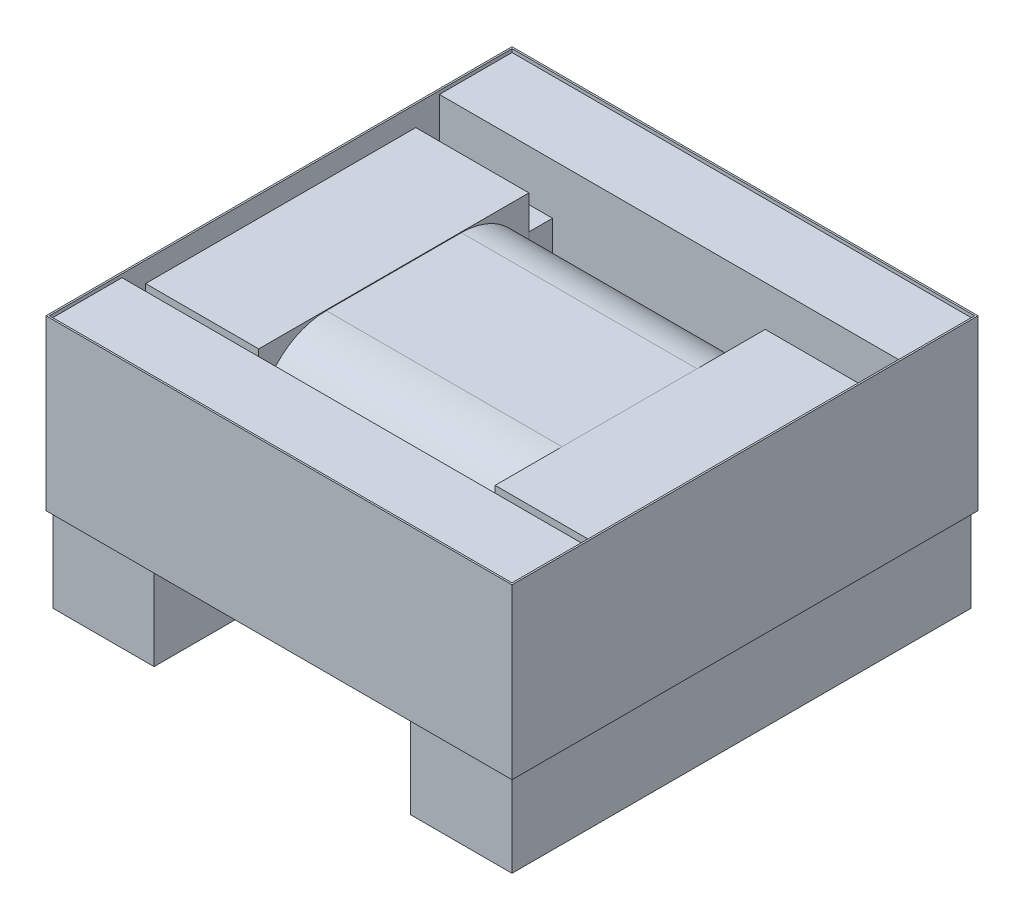
from build123d import *

# Parameters (mm, degrees)
ESBO_O1_W                = 13.8
ESBO_O1_H                = 13.8
RESSALTO_EXTRUS_O1_DEPTH = 5
ESBO_O3_W                = 3
ESBO_O3_H                = 13.6
RESSALTO_EXTRUS_O3_DEPTH = 2.5
ESBO_O4_W                = 13.7
ESBO_O4_H                = 13.7
CORTE_EXTRUS_O1_DEPTH    = 0.1
ESBO_O5_W                = 13.7
ESBO_O5_H                = 9.4
CORTE_EXTRUS_O2_DEPTH    = 0.5
ESBO_O6_W                = 13.7
ESBO_O6_H                = 0.7
CORTE_EXTRUS_O3_DEPTH    = 1
ESBO_O7_W                = 7
ESBO_O7_H                = 0.7
CORTE_EXTRUS_O4_DEPTH    = 10
ESBO_O8_W                = 7
ESBO_O8_H                = 8
CORTE_EXTRUS_O5_DEPTH    = 0.02
FILETE1_R                = 2


with BuildPart() as part:
    # Esboço1 → Ressalto-extrusão1 (new body)
    with BuildSketch(Plane(origin=(0, 0, 0), x_dir=(1, 0, 0), z_dir=(0, 1, 0))):
        Rectangle(ESBO_O1_W, ESBO_O1_H)
    extrude(amount=RESSALTO_EXTRUS_O1_DEPTH)

    # Esboço3 → Ressalto-extrusão3 (add)
    with BuildSketch(Plane.XZ):
        with Locations((-5.3, 0)):
            Rectangle(ESBO_O3_W, ESBO_O3_H)
        with Locations((5.3, 0)):
            Rectangle(ESBO_O3_W, ESBO_O3_H)
    extrude(amount=RESSALTO_EXTRUS_O3_DEPTH)

    # Esboço4 → Corte-extrusão1 (cut)
    with BuildSketch(Plane(origin=(0, 5, 0), x_dir=(1, 0, 0), z_dir=(0, 1, 0))):
        Rectangle(ESBO_O4_W, ESBO_O4_H)
    extrude(amount=-CORTE_EXTRUS_O1_DEPTH, mode=Mode.SUBTRACT)

    # Esboço5 → Corte-extrusão2 (cut)
    with BuildSketch(Plane(origin=(0, 4.9, 0), x_dir=(1, 0, 0), z_dir=(0, 1, 0))):
        Rectangle(ESBO_O5_W, ESBO_O5_H)
    extrude(amount=-CORTE_EXTRUS_O2_DEPTH, mode=Mode.SUBTRACT)

    # Esboço6 → Corte-extrusão3 (cut)
    with BuildSketch(Plane(origin=(0, 4.4, 0), x_dir=(-1, 0, 0), z_dir=(0, 1, 0))):
        with Locations((0, -4.35)):
            Rectangle(ESBO_O6_W, ESBO_O6_H)
        with Locations((0, 4.35)):
            Rectangle(ESBO_O6_W, ESBO_O6_H)
    extrude(amount=-CORTE_EXTRUS_O3_DEPTH, mode=Mode.SUBTRACT)

    # Esboço7 → Corte-extrusão4 (cut)
    with BuildSketch(Plane(origin=(0, 3.4, 0), x_dir=(1, 0, 0), z_dir=(0, 1, 0))):
        with Locations((0, 4.35)):
            Rectangle(ESBO_O7_W, ESBO_O7_H)
        with Locations((0, -4.35)):
            Rectangle(ESBO_O7_W, ESBO_O7_H)
    extrude(amount=-CORTE_EXTRUS_O4_DEPTH, mode=Mode.SUBTRACT)

    # Esboço8 → Corte-extrusão5 (cut)
    with BuildSketch(Plane(origin=(0, 4.4, 0), x_dir=(1, 0, 0), z_dir=(0, 1, 0))):
        Rectangle(ESBO_O8_W, ESBO_O8_H)
    extrude(amount=-CORTE_EXTRUS_O5_DEPTH, mode=Mode.SUBTRACT)

    # Filete1
    # the kernel refuses this fillet: 2 mm, written as the material it takes off along each edge
    with BuildSketch(Plane(origin=(-3.5, 4.38, -4), x_dir=(0, -1, 0), z_dir=(1, 0, 0)), Plane(origin=(3.5, 4.38, 4), x_dir=(0, -1, 0), z_dir=(-1, 0, 0))) as filete1_piece_1:
        with BuildLine():
            CenterArc((FILETE1_R, -FILETE1_R), FILETE1_R, 90, 90)
            Line((0, -FILETE1_R), (0, 0))
            Line((0, 0), (FILETE1_R, 0))
        make_face()
    extrude(amount=7, mode=Mode.SUBTRACT)


solid = part.part
